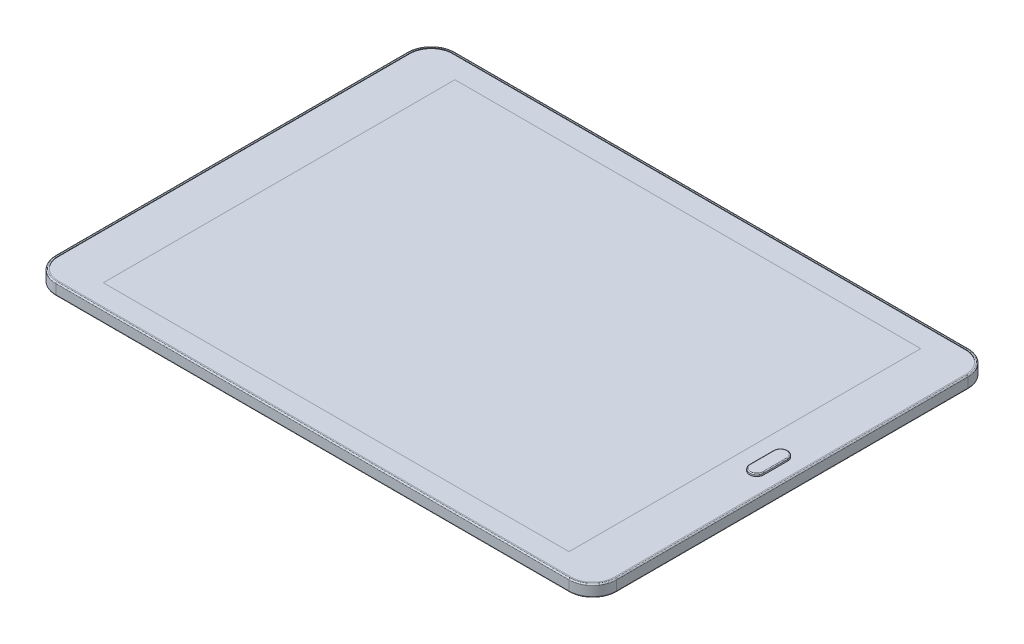
from build123d import *

# Parameters (mm, degrees)
BOSS_EXTRUDE1_DEPTH = 5
CUT_EXTRUDE1_DEPTH  = 0.2
BOSS_EXTRUDE2_DEPTH = 1
FILLET1_R           = 0.4
BOSS_EXTRUDE3_DEPTH = 1
CUT_EXTRUDE2_DEPTH  = 0.2
FILLET2_R           = 0.8
SKETCH9_R           = 3
CUT_EXTRUDE3_DEPTH  = 0.2
FILLET3_R           = 0.5
BOSS_EXTRUDE4_DEPTH = 1
FILLET4_R           = 0.5
FILLET5_R           = 0.5
FILLET7_R           = 0.2


with BuildPart() as part:
    # Sketch1 → Boss-Extrude1 (new body)
    with BuildSketch(Plane(origin=(0, 0, 0), x_dir=(1, 0, 0), z_dir=(0, 1, 0))):
        with BuildLine():
            Line((108, 84), (-108, 84))
            ThreePointArc((-108, 84), (-115.071067812, 81.071067812), (-118, 74))
            Line((-118, 74), (-118, -74))
            ThreePointArc((-118, -74), (-115.071067812, -81.071067812), (-108, -84))
            Line((-108, -84), (108, -84))
            ThreePointArc((108, -84), (115.071067812, -81.071067812), (118, -74))
            Line((118, -74), (118, 74))
            ThreePointArc((118, 74), (115.071067812, 81.071067812), (108, 84))
        make_face()
    extrude(amount=BOSS_EXTRUDE1_DEPTH)

    # Sketch2 → Cut-Extrude1 (cut)
    with BuildSketch(Plane(origin=(0, 5, 0), x_dir=(1, 0, 0), z_dir=(0, 1, 0))):
        with BuildLine():
            Line((-108, -83), (108, -83))
            ThreePointArc((108, -83), (114.363961031, -80.363961031), (117, -74))
            Line((117, -74), (117, 74))
            ThreePointArc((117, 74), (114.363961031, 80.363961031), (108, 83))
            Line((108, 83), (-108, 83))
            ThreePointArc((-108, 83), (-114.363961031, 80.363961031), (-117, 74))
            Line((-117, 74), (-117, -74))
            ThreePointArc((-117, -74), (-114.363961031, -80.363961031), (-108, -83))
        make_face()
    extrude(amount=-CUT_EXTRUDE1_DEPTH, mode=Mode.SUBTRACT)

    # Sketch6 → Boss-Extrude2 (add)
    with BuildSketch(Plane(origin=(0, 4.8, 0), x_dir=(1, 0, 0), z_dir=(0, 1, 0))):
        with BuildLine():
            Line((111, 5), (111, -5))
            ThreePointArc((111, -5), (108, -8), (105, -5))
            Line((105, -5), (105, 5))
            ThreePointArc((105, 5), (108, 8), (111, 5))
        make_face()
    extrude(amount=BOSS_EXTRUDE2_DEPTH)

    # Fillet1
    fillet1_edges = [part.edges().sort_by_distance(p)[0] for p in [
        (108, 5.8, -8),
        (105, 5.8, 0),
        (108, 5.8, 8),
        (111, 5.8, 0),
    ]]
    fillet(fillet1_edges, radius=FILLET1_R)

    # Sketch7 → Boss-Extrude3 (add)
    with BuildSketch(Plane.XZ):
        with BuildLine():
            Line((-112, 6), (-106, 6))
            ThreePointArc((-106, 6), (-103.878679656, 5.121320344), (-103, 3))
            Line((-103, 3), (-103, -3))
            ThreePointArc((-103, -3), (-103.878679656, -5.121320344), (-106, -6))
            Line((-106, -6), (-112, -6))
            ThreePointArc((-112, -6), (-114.121320344, -5.121320344), (-115, -3))
            Line((-115, -3), (-115, 3))
            ThreePointArc((-115, 3), (-114.121320344, 5.121320344), (-112, 6))
        make_face()
    extrude(amount=BOSS_EXTRUDE3_DEPTH)

    # Sketch8 → Cut-Extrude2 (cut)
    with BuildSketch(Plane.XZ.offset(1)):
        with BuildLine():
            Line((-112, -5), (-106, -5))
            ThreePointArc((-106, -5), (-104.585786438, -4.414213562), (-104, -3))
            Line((-104, -3), (-104, 3))
            ThreePointArc((-104, 3), (-104.585786438, 4.414213562), (-106, 5))
            Line((-106, 5), (-112, 5))
            ThreePointArc((-112, 5), (-113.414213562, 4.414213562), (-114, 3))
            Line((-114, 3), (-114, -3))
            ThreePointArc((-114, -3), (-113.414213562, -4.414213562), (-112, -5))
        make_face()
    extrude(amount=-CUT_EXTRUDE2_DEPTH, mode=Mode.SUBTRACT)

    # Fillet2
    fillet2_edges = [part.edges().sort_by_distance(p)[0] for p in [
        (-114.121320344, 0, -5.121320344),
        (-109, 0, -6),
        (-103.878679656, 0, -5.121320344),
        (-103, 0, 0),
        (-103.878679656, 0, 5.121320344),
        (-109, 0, 6),
        (-114.121320344, 0, 5.121320344),
        (-115, 0, 0),
    ]]
    fillet(fillet2_edges, radius=FILLET2_R)

    # Sketch9 → Cut-Extrude3 (cut)
    with BuildSketch(Plane.XZ):
        with Locations(Location((-90.5, 68, 0), (0, 0, 270))):
            Circle(SKETCH9_R)
        with Locations(Location((90.5, 68, 0), (0, 0, 270))):
            Circle(SKETCH9_R)
    extrude(amount=-CUT_EXTRUDE3_DEPTH, mode=Mode.SUBTRACT)

    # Fillet3
    fillet3_edges = [part.edges().sort_by_distance(p)[0] for p in [
        (118, 0, 0),
        (115.071067812, 0, 81.071067812),
        (0, 0, 84),
        (-115.071067812, 0, 81.071067812),
        (-118, 0, 0),
        (-115.071067812, 0, -81.071067812),
        (0, 0, -84),
        (115.071067812, 0, -81.071067812),
    ]]
    fillet(fillet3_edges, radius=FILLET3_R)

    # Sketch10 → Boss-Extrude4 (add)
    with BuildSketch(Plane(origin=(0, 0, -84), x_dir=(-1, 0, 0), z_dir=(0, 0, -1))):
        with BuildLine():
            Line((48, 2.7), (48, 2.8))
            ThreePointArc((48, 2.8), (48.205025253, 3.294974747), (48.7, 3.5))
            Line((48.7, 3.5), (68.3, 3.5))
            ThreePointArc((68.3, 3.5), (68.794974747, 3.294974747), (69, 2.8))
            Line((69, 2.8), (69, 2.7))
            ThreePointArc((69, 2.7), (68.794974747, 2.205025253), (68.3, 2))
            Line((68.3, 2), (48.7, 2))
            ThreePointArc((48.7, 2), (48.205025253, 2.205025253), (48, 2.7))
        make_face()
        with BuildLine():
            Line((91, 2.7), (91, 2.8))
            ThreePointArc((91, 2.8), (90.794974747, 3.294974747), (90.3, 3.5))
            Line((90.3, 3.5), (79.7, 3.5))
            ThreePointArc((79.7, 3.5), (79.205025253, 3.294974747), (79, 2.8))
            Line((79, 2.8), (79, 2.7))
            ThreePointArc((79, 2.7), (79.205025253, 2.205025253), (79.7, 2))
            Line((79.7, 2), (90.3, 2))
            ThreePointArc((90.3, 2), (90.794974747, 2.205025253), (91, 2.7))
        make_face()
    extrude(amount=BOSS_EXTRUDE4_DEPTH)

    # Fillet4
    fillet4_edges = [part.edges().sort_by_distance(p)[0] for p in [
        (115.071067812, 5, 81.071067812),
        (118, 5, 0),
        (115.071067812, 5, -81.071067812),
        (0, 5, -84),
        (-115.071067812, 5, -81.071067812),
        (-118, 5, 0),
        (-115.071067812, 5, 81.071067812),
        (0, 5, 84),
    ]]
    fillet(fillet4_edges, radius=FILLET4_R)

    # Fillet5
    fillet5_edges = [part.edges().sort_by_distance(p)[0] for p in [
        (-114.121320344, -1, 5.121320344),
        (-109, -1, 6),
        (-103.878679656, -1, 5.121320344),
        (-103, -1, 0),
        (-103.878679656, -1, -5.121320344),
        (-109, -1, -6),
        (-114.121320344, -1, -5.121320344),
        (-115, -1, 0),
    ]]
    fillet(fillet5_edges, radius=FILLET5_R)

    # Fillet7
    fillet7_edges = [part.edges().sort_by_distance(p)[0] for p in [
        (-90.5, 0, 71),
        (90.5, 0, 71),
    ]]
    fillet(fillet7_edges, radius=FILLET7_R - 0.0001)  # a hair under: the kernel refuses the full size


solid = part.part
